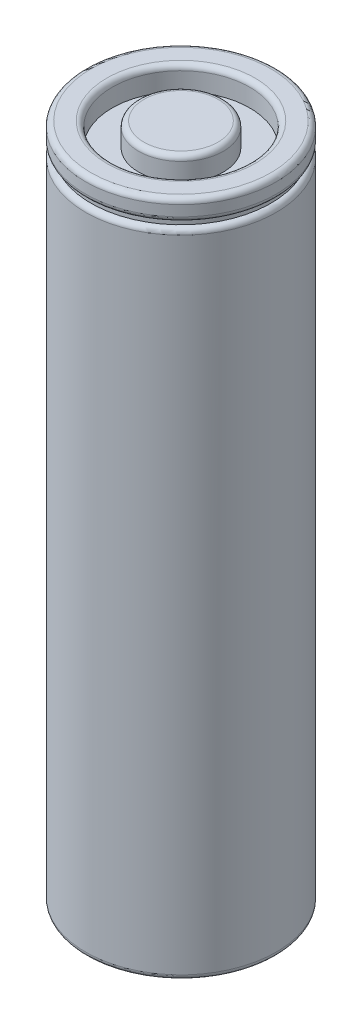
from build123d import *

# Parameters (mm, degrees)
FILLET1_R           = 0.5
SKETCH4_R           = 6.5
CUT_EXTRUDE1_DEPTH  = 2.2
SKETCH5_R           = 4
BOSS_EXTRUDE1_DEPTH = 2.2
FILLET2_R           = 0.5


with BuildPart() as part:
    # Sketch2 → Revolve1 (revolve)
    with BuildSketch(Plane(origin=(0, 0, 0), x_dir=(0, 0, -1), z_dir=(1, 0, 0))):
        Polygon((9, 62), (8.5, 62), (8.5, 61.5), (9, 61.5), (9, 0), (0, 0), (0, 64), (9, 64), align=None)
    revolve(axis=Axis((0, 0, 0), (0, 1, 0)))

    # Fillet1
    fillet1_edges = [part.edges().sort_by_distance(p)[0] for p in [
        (0, 0, 9),
        (0, 61.5, 9),
        (0, 62, 9),
    ]]
    fillet(fillet1_edges, radius=FILLET1_R - 0.0001)  # a hair under: the kernel refuses the full size

    # Sketch4 → Cut-Extrude1 (cut)
    with BuildSketch(Plane(origin=(0, 64, 0), x_dir=(1, 0, 0), z_dir=(0, 1, 0))):
        with Locations(Location((0, 0, 0), (0, 0, 270))):
            Circle(SKETCH4_R)
    extrude(amount=-CUT_EXTRUDE1_DEPTH, mode=Mode.SUBTRACT)

    # Sketch5 → Boss-Extrude1 (add)
    with BuildSketch(Plane(origin=(0, 61.8, 0), x_dir=(1, 0, 0), z_dir=(0, 1, 0))):
        with Locations(Location((0, 0, 0), (0, 0, 270))):
            Circle(SKETCH5_R)
    extrude(amount=BOSS_EXTRUDE1_DEPTH)

    # Fillet2
    fillet2_edges = [part.edges().sort_by_distance(p)[0] for p in [
        (0, 64, -6.5),
        (0, 64, -4),
        (0, 64, 9),
    ]]
    fillet(fillet2_edges, radius=FILLET2_R)


solid = part.part
